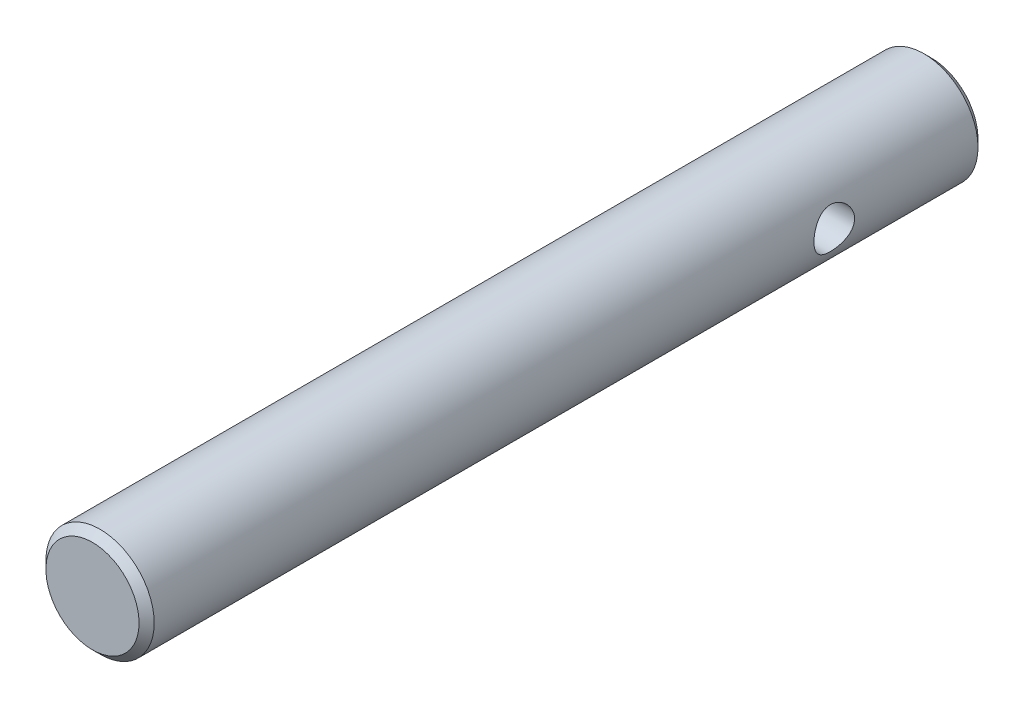
from build123d import *

# Parameters (mm, degrees)
BOSS_EXTRUDE1_DEPTH      = 30.988
BOSS_EXTRUDE1_DEPTH_BACK = 30.988
SKETCH1_R                = 4
CUT_EXTRUDE1_START       = -4.000000101
CUT_EXTRUDE1_OUTLINE_R   = 1.500000048
CUT_EXTRUDE1_DEPTH       = 8.000000202
CHAMFER1_SIZE            = 0.56


# Read off the part's stored shape, not the designer's step: Cut-Extrude1
with BuildPart() as part:
    # Sketch1 → Boss-Extrude1 (new, two sides: drawn at the far end of the back side and taken through both)
    with BuildSketch(Plane.XY.offset(-BOSS_EXTRUDE1_DEPTH_BACK)):
        Circle(SKETCH1_R)
    extrude(amount=BOSS_EXTRUDE1_DEPTH + BOSS_EXTRUDE1_DEPTH_BACK)

    # Cut-Extrude1 outline → Cut-Extrude1 (cut)
    with BuildSketch(Plane.YZ.offset(CUT_EXTRUDE1_START)):
        with Locations((0, -19.812)):
            Circle(CUT_EXTRUDE1_OUTLINE_R)
    extrude(amount=CUT_EXTRUDE1_DEPTH, mode=Mode.SUBTRACT)

    # Chamfer1
    chamfer1_edges = [part.edges().sort_by_distance(p)[0] for p in [
        (-4, 0, -30.988),
        (-4, 0, 30.988),
    ]]
    chamfer(chamfer1_edges, length=CHAMFER1_SIZE)


solid = part.part
